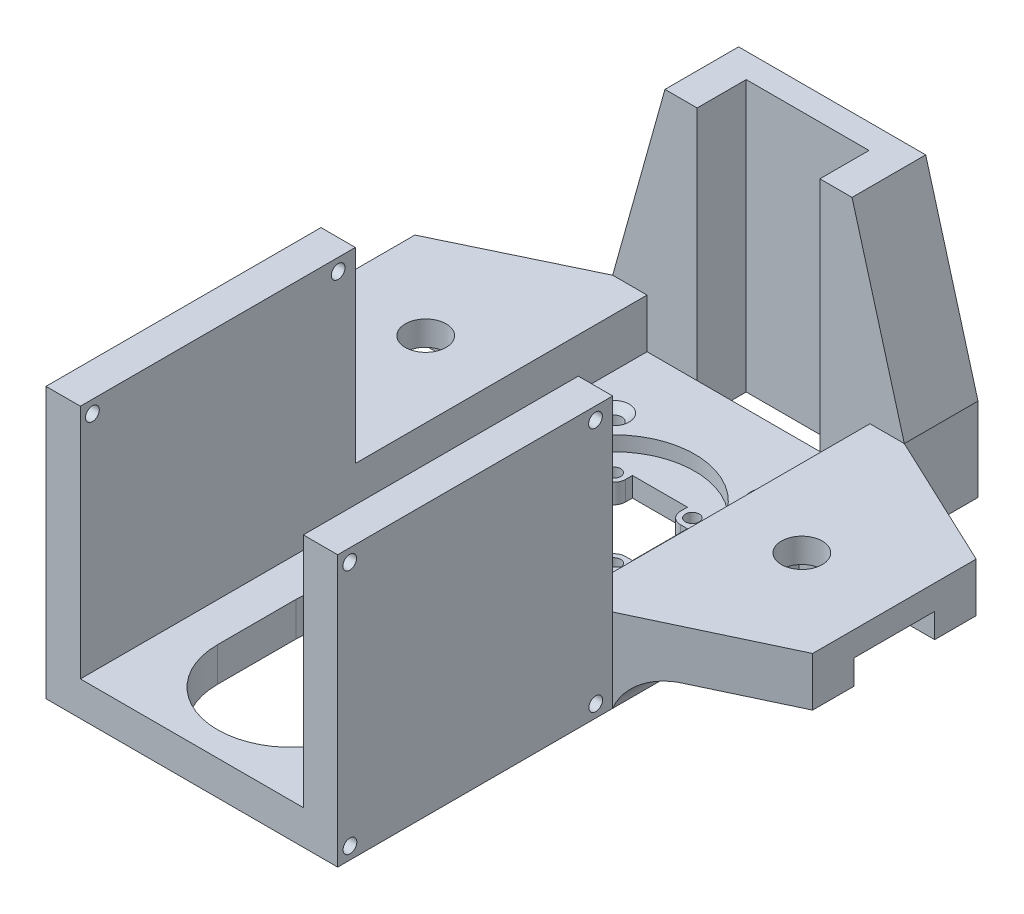
from build123d import *

# Parameters (mm, degrees)
SKETCH1_W           = 59.4
SKETCH1_H           = 59.4
BOSS_EXTRUDE1_DEPTH = 7
SKETCH2_R           = 16.5
CUT_EXTRUDE1_DEPTH  = 3
SKETCH4_R           = 1.65
CUT_EXTRUDE2_DEPTH  = 7
CHAMFER1_SIZE       = 1.5
SKETCH5_R           = 1.4
CUT_EXTRUDE3_DEPTH  = 7
SKETCH6_W           = 7
SKETCH6_H           = 59.4
BOSS_EXTRUDE2_DEPTH = 10
SKETCH7_W           = 27.226691729
SKETCH7_H           = 59.4
SKETCH7_W_2         = 27.673308271
BOSS_EXTRUDE3_DEPTH = 10
SKETCH8_R           = 4.165
CUT_EXTRUDE4_DEPTH  = 10
SKETCH9_W           = 30
SKETCH9_H           = 16.4
SKETCH9_W_2         = 36.39158208
CUT_EXTRUDE5_DEPTH  = 5
CUT_EXTRUDE6_DEPTH  = 10
BOSS_EXTRUDE4_DEPTH = 15
SKETCH12_W          = 25
SKETCH12_H          = 10
CUT_EXTRUDE7_DEPTH  = 90
SKETCH13_R          = 5.3
SKETCH13_R_2        = 3.3
BOSS_EXTRUDE5_DEPTH = 10
SKETCH14_R          = 1.4
CUT_EXTRUDE8_DEPTH  = 10
SKETCH17_W          = 7
SKETCH17_H          = 38.1
SKETCH17_W_2        = 45.4
SKETCH17_H_2        = 7
BOSS_EXTRUDE8_DEPTH = 56
FILLET1_R           = 10
SKETCH18_R          = 1.4
CUT_EXTRUDE10_DEPTH = 65
CUT_EXTRUDE12_DEPTH = 10


with BuildPart() as part:
    # Sketch1 → Boss-Extrude1 (new body)
    with BuildSketch(Plane(origin=(0, 0, 0), x_dir=(1, 0, 0), z_dir=(0, 1, 0))):
        with Locations((-0.223308271, -13.90093985)):
            Rectangle(SKETCH1_W, SKETCH1_H)
    extrude(amount=BOSS_EXTRUDE1_DEPTH)

    # Sketch2 → Cut-Extrude1 (cut)
    with BuildSketch(Plane(origin=(0, 7, 0), x_dir=(1, 0, 0), z_dir=(0, 1, 0))):
        with Locations(Location((0, -13.90093985, 0), (0, 0, 270))):
            Circle(SKETCH2_R)
    extrude(amount=-CUT_EXTRUDE1_DEPTH, mode=Mode.SUBTRACT)

    # Sketch4 → Cut-Extrude2 (cut)
    with BuildSketch(Plane(origin=(0, 7, 0), x_dir=(1, 0, 0), z_dir=(0, 1, 0))):
        with Locations(Location((-15.5, 1.59906015, 0), (0, 0, 270))):
            Circle(SKETCH4_R)
        with Locations(Location((15.5, 1.59906015, 0), (0, 0, 270))):
            Circle(SKETCH4_R)
        with Locations(Location((15.5, -29.40093985, 0), (0, 0, 270))):
            Circle(SKETCH4_R)
        with Locations(Location((-15.5, -29.40093985, 0), (0, 0, 270))):
            Circle(SKETCH4_R)
    extrude(amount=-CUT_EXTRUDE2_DEPTH, mode=Mode.SUBTRACT)

    # Chamfer1
    chamfer1_edges = [part.edges().sort_by_distance(p)[0] for p in [
        (-15.5, 7, 27.75093985),
        (15.5, 7, 27.75093985),
        (15.5, 7, -3.24906015),
        (-15.5, 7, -3.24906015),
    ]]
    chamfer(chamfer1_edges, length=CHAMFER1_SIZE)

    # Sketch5 → Cut-Extrude3 (cut)
    with BuildSketch(Plane(origin=(0, 4, 0), x_dir=(1, 0, 0), z_dir=(0, 1, 0))):
        with BuildLine():
            Line((9.4, -13.90093985), (0, -13.90093985))
            Line((0, -13.90093985), (0, -23.30093985))
            Line((0, -23.30093985), (5.6, -23.30093985))
            Line((5.6, -23.30093985), (5.6, -21.90093985))
            ThreePointArc((5.6, -21.90093985), (6.302943725, -20.203883575), (8, -19.50093985))
            Line((8, -19.50093985), (9.4, -19.50093985))
            Line((9.4, -19.50093985), (9.4, -13.90093985))
        make_face()
        with BuildLine():
            Line((0, -13.90093985), (-9.4, -13.90093985))
            Line((-9.4, -13.90093985), (-9.4, -19.50093985))
            Line((-9.4, -19.50093985), (-8, -19.50093985))
            ThreePointArc((-8, -19.50093985), (-6.302943725, -20.203883575), (-5.6, -21.90093985))
            Line((-5.6, -21.90093985), (-5.6, -23.30093985))
            Line((-5.6, -23.30093985), (0, -23.30093985))
            Line((0, -23.30093985), (0, -13.90093985))
        make_face()
        with BuildLine():
            ThreePointArc((-5.6, -5.90093985), (-6.302943725, -7.597996124), (-8, -8.30093985))
            Line((-8, -8.30093985), (-9.4, -8.30093985))
            Line((-9.4, -8.30093985), (-9.4, -13.90093985))
            Line((-9.4, -13.90093985), (0, -13.90093985))
            Line((0, -13.90093985), (0, -4.50093985))
            Line((0, -4.50093985), (-5.6, -4.50093985))
            Line((-5.6, -4.50093985), (-5.6, -5.90093985))
        make_face()
        with BuildLine():
            Line((0, -4.50093985), (0, -13.90093985))
            Line((0, -13.90093985), (9.4, -13.90093985))
            Line((9.4, -13.90093985), (9.4, -8.30093985))
            Line((9.4, -8.30093985), (8, -8.30093985))
            ThreePointArc((8, -8.30093985), (6.302943725, -7.597996124), (5.6, -5.90093985))
            Line((5.6, -5.90093985), (5.6, -4.50093985))
            Line((5.6, -4.50093985), (0, -4.50093985))
        make_face()
        with Locations(Location((8, -5.90093985, 0), (0, 0, 270))):
            Circle(SKETCH5_R)
        with Locations(Location((-8, -5.90093985, 0), (0, 0, 270))):
            Circle(SKETCH5_R)
        with Locations(Location((-8, -21.90093985, 0), (0, 0, 270))):
            Circle(SKETCH5_R)
        with Locations(Location((8, -21.90093985, 0), (0, 0, 270))):
            Circle(SKETCH5_R)
    extrude(amount=-CUT_EXTRUDE3_DEPTH, mode=Mode.SUBTRACT)

    # Sketch6 → Boss-Extrude2 (add)
    with BuildSketch(Plane(origin=(0, 7, 0), x_dir=(1, 0, 0), z_dir=(0, 1, 0))):
        with Locations((-26.423308271, -13.90093985)):
            Rectangle(SKETCH6_W, SKETCH6_H)
        with Locations((25.976691729, -13.90093985)):
            Rectangle(SKETCH6_W, SKETCH6_H)
    extrude(amount=BOSS_EXTRUDE2_DEPTH)

    # Sketch7 → Boss-Extrude3 (add)
    with BuildSketch(Plane(origin=(0, 17, 0), x_dir=(1, 0, 0), z_dir=(0, 1, 0))):
        with Locations((-43.536654136, -13.90093985)):
            Rectangle(SKETCH7_W, SKETCH7_H)
        with Locations((43.313345865, -13.90093985)):
            Rectangle(SKETCH7_W_2, SKETCH7_H)
    extrude(amount=-BOSS_EXTRUDE3_DEPTH)

    # Sketch8 → Cut-Extrude4 (cut)
    with BuildSketch(Plane.XZ.offset(-7)):
        with Locations(Location((-38.3, 13.90093985, 0), (0, 0, 270))):
            Circle(SKETCH8_R)
        with Locations(Location((38.3, 13.90093985, 0), (0, 0, 270))):
            Circle(SKETCH8_R)
    extrude(amount=-CUT_EXTRUDE4_DEPTH, mode=Mode.SUBTRACT)

    # Sketch9 → Cut-Extrude5 (cut)
    with BuildSketch(Plane.XZ.offset(-7)):
        with Locations((-44.923308271, 13.90093985)):
            Rectangle(SKETCH9_W, SKETCH9_H)
        with Locations((47.672482769, 13.90093985)):
            Rectangle(SKETCH9_W_2, SKETCH9_H)
    extrude(amount=-CUT_EXTRUDE5_DEPTH, mode=Mode.SUBTRACT)

    # Sketch10 → Cut-Extrude6 (cut)
    with BuildSketch(Plane.XZ.offset(-7)):
        Polygon((29.476691729, 43.60093985), (57.15, 30.55093985), (76.62509514, 37.490170253), (62.940914395, 60.152042306), align=None)
        Polygon((29.476691729, -15.79906015), (57.15, -2.74906015), (74.309790283, -17.328421705), (51.423897195, -33.903905564), align=None)
        Polygon((-29.923308271, 43.60093985), (-57.15, 30.55093985), (-87.322044428, 42.719817872), (-44.416875265, 63.284654142), align=None)
        Polygon((-29.923308271, -15.79906015), (-57.15, -2.74906015), (-80.43240027, -17.331293655), (-52.631456994, -33.827579257), align=None)
    extrude(amount=-CUT_EXTRUDE6_DEPTH, mode=Mode.SUBTRACT)

    # Sketch11 → Boss-Extrude4 (add)
    with BuildSketch(Plane(origin=(0, 0, -15.79906015), x_dir=(-1, 0, 0), z_dir=(0, 0, -1))):
        Polygon((-29.476691729, 17), (-29.476691729, 0), (29.923308271, 0), (29.923308271, 17), (19.273308271, 55.1), (-18.826691729, 55.1), align=None)
    extrude(amount=BOSS_EXTRUDE4_DEPTH)

    # Sketch12 → Cut-Extrude7 (cut)
    with BuildSketch(Plane(origin=(0, 55.1, 0), x_dir=(1, 0, 0), z_dir=(0, 1, 0))):
        with Locations((-0.223308271, 20.79906015)):
            Rectangle(SKETCH12_W, SKETCH12_H)
    extrude(amount=-CUT_EXTRUDE7_DEPTH, mode=Mode.SUBTRACT)

    # Sketch13 → Boss-Extrude5 (add)
    # profile 1 of 2: a face of its own
    with BuildSketch(Plane.XZ):
        with BuildLine():
            Line((-29.923308271, -30.79906015), (-3.367178173, -50.365918718))
            ThreePointArc((-3.367178173, -50.365918718), (-2.613652338, -41.368705487), (5.076691729, -46.09906015))
            ThreePointArc((5.076691729, -46.09906015), (4.507046393, -48.489404218), (2.920561631, -50.365918718))
            Line((2.920561631, -50.365918718), (29.476691729, -30.79906015))
            Line((29.476691729, -30.79906015), (-29.923308271, -30.79906015))
        make_face()
    # profile 2 of 2: a face of its own
    with BuildSketch(Plane.XZ):
        with Locations((-0.223308271, -46.09906015)):
            Circle(SKETCH13_R)
        with Locations(Location((-0.223308271, -46.09906015, 0), (0, 0, 270))):
            Circle(SKETCH13_R_2, mode=Mode.SUBTRACT)
    extrude(amount=-BOSS_EXTRUDE5_DEPTH)

    # Sketch14 → Cut-Extrude8 (cut)
    with BuildSketch(Plane(origin=(0, 0, -30.79906015), x_dir=(-1, 0, 0), z_dir=(0, 0, -1))):
        with Locations((-24.776691729, 12.7)):
            Circle(SKETCH14_R)
        with Locations((25.223308271, 12.7)):
            Circle(SKETCH14_R)
    extrude(amount=-CUT_EXTRUDE8_DEPTH, mode=Mode.SUBTRACT)

    # Sketch17 → Boss-Extrude8 (add)
    with BuildSketch(Plane.XY.offset(43.60093985)):
        with Locations((-26.423308271, 36.05)):
            Rectangle(SKETCH17_W, SKETCH17_H)
        Polygon((-22.923308271, 0), (-22.923308271, 7), (-22.923308271, 17), (-29.923308271, 17), (-29.923308271, 7), (-29.923308271, 0), align=None)
        with Locations((-0.223308271, 3.5)):
            Rectangle(SKETCH17_W_2, SKETCH17_H_2)
        Polygon((22.476691729, 17), (22.476691729, 7), (22.476691729, 0), (29.476691729, 0), (29.476691729, 7), (29.476691729, 17), align=None)
        with Locations((25.976691729, 36.05)):
            Rectangle(SKETCH17_W, SKETCH17_H)
    extrude(amount=BOSS_EXTRUDE8_DEPTH)

    # Fillet1
    # the kernel refuses this fillet: 10 mm, written as the material it adds along each edge
    with BuildSketch(Plane(origin=(-29.923308271, 7, 67.449419885), x_dir=(0, -1, 0), z_dir=(0, 0, -1))) as fillet1_piece_1_section:
        with BuildLine():
            CenterArc((10, 9.539392014), FILLET1_R, 180, 72.542396876)
            Line((0, 9.539392014), (-0.2, 9.539392014))
            Line((-0.2, 9.539392014), (-0.2, 0))
            Line((-0.2, 0), (0, -0.2))
            ThreePointArc((0, -0.2), (3.5, -0.2), (6.94, -0.19078784))
            Line((6.94, -0.19078784), (7, 0))
        make_face()
    fillet1_piece_1 = extrude(amount=45.348480035, mode=Mode.PRIVATE)
    fillet1_piece_1 = split(fillet1_piece_1, bisect_by=Plane(origin=(-36.079766586, 5.164687133, 40.650093606), z_dir=(0.43222460559101666, 0, -0.9017659842340973)), keep=Keep.TOP, mode=Mode.PRIVATE)
    add(fillet1_piece_1)
    with BuildSketch(Plane(origin=(-29.923308271, 7, 67.449419885), x_dir=(0, -1, 0), z_dir=(0, 0, -1))) as fillet1_piece_2_section:
        with BuildLine():
            CenterArc((10, 9.539392014), FILLET1_R, 180, 72.542396876)
            Line((0, 9.539392014), (-0.2, 9.539392014))
            Line((-0.2, 9.539392014), (-0.2, 0))
            Line((-0.2, 0), (0, -0.2))
            ThreePointArc((0, -0.2), (3.5, -0.2), (6.94, -0.19078784))
            Line((6.94, -0.19078784), (7, 0))
        make_face()
    fillet1_piece_2 = extrude(amount=69.196960071, mode=Mode.PRIVATE)
    fillet1_piece_2 = split(fillet1_piece_2, bisect_by=Plane(origin=(-32.194534149, 5.212182004, 5.70093985), z_dir=(0, 0, -1)), keep=Keep.TOP, mode=Mode.PRIVATE)
    add(fillet1_piece_2)
    with BuildSketch(Plane(origin=(29.476691729, 7, -39.647540186), x_dir=(0, -1, 0), z_dir=(0, 0, 1))) as fillet1_piece_3_section:
        with BuildLine():
            CenterArc((10, 9.539392014), FILLET1_R, 180, 72.542396876)
            Line((0, 9.539392014), (-0.2, 9.539392014))
            Line((-0.2, 9.539392014), (-0.2, 0))
            Line((-0.2, 0), (0, -0.2))
            ThreePointArc((0, -0.2), (3.5, -0.2), (6.94, -0.19078784))
            Line((6.94, -0.19078784), (7, 0))
        make_face()
    fillet1_piece_3 = extrude(amount=45.348480035, mode=Mode.PRIVATE)
    fillet1_piece_3 = split(fillet1_piece_3, bisect_by=Plane(origin=(35.597218228, 5.165493834, -12.91278179), z_dir=(-0.4265265085615614, 0, 0.9044750618421077)), keep=Keep.TOP, mode=Mode.PRIVATE)
    add(fillet1_piece_3)
    with BuildSketch(Plane(origin=(29.476691729, 7, -39.647540186), x_dir=(0, -1, 0), z_dir=(0, 0, 1))) as fillet1_piece_4_section:
        with BuildLine():
            CenterArc((10, 9.539392014), FILLET1_R, 180, 72.542396876)
            Line((0, 9.539392014), (-0.2, 9.539392014))
            Line((-0.2, 9.539392014), (-0.2, 0))
            Line((-0.2, 0), (0, -0.2))
            ThreePointArc((0, -0.2), (3.5, -0.2), (6.94, -0.19078784))
            Line((6.94, -0.19078784), (7, 0))
        make_face()
    fillet1_piece_4 = extrude(amount=69.196960071, mode=Mode.PRIVATE)
    fillet1_piece_4 = split(fillet1_piece_4, bisect_by=Plane(origin=(31.747917608, 5.212182004, 22.10093985), z_dir=(0, 0, 1)), keep=Keep.TOP, mode=Mode.PRIVATE)
    add(fillet1_piece_4)
    with BuildSketch(Plane(origin=(29.476691729, 7, -1.747540186), x_dir=(0, -1, 0), z_dir=(0, 0, 1))) as fillet1_piece_5_section:
        with BuildLine():
            CenterArc((10, 9.539392014), FILLET1_R, 180, 72.542396876)
            Line((0, 9.539392014), (-0.2, 9.539392014))
            Line((-0.2, 9.539392014), (-0.2, 0))
            Line((-0.2, 0), (0, -0.2))
            ThreePointArc((0, -0.2), (3.5, -0.2), (6.94, -0.19078784))
            Line((6.94, -0.19078784), (7, 0))
        make_face()
    fillet1_piece_5 = extrude(amount=69.196960071, mode=Mode.PRIVATE)
    fillet1_piece_5 = split(fillet1_piece_5, bisect_by=Plane(origin=(31.747917608, 5.212182004, 5.70093985), z_dir=(0, 0, -1)), keep=Keep.TOP, mode=Mode.PRIVATE)
    add(fillet1_piece_5)
    with BuildSketch(Plane(origin=(29.476691729, 7, 22.10093985), x_dir=(0, -1, 0), z_dir=(0, 0, 1))) as fillet1_piece_6_section:
        with BuildLine():
            CenterArc((10, 9.539392014), FILLET1_R, 180, 72.542396876)
            Line((0, 9.539392014), (-0.2, 9.539392014))
            Line((-0.2, 9.539392014), (-0.2, 0))
            Line((-0.2, 0), (0, -0.2))
            ThreePointArc((0, -0.2), (3.5, -0.2), (6.94, -0.19078784))
            Line((6.94, -0.19078784), (7, 0))
        make_face()
    fillet1_piece_6 = extrude(amount=45.348480035, mode=Mode.PRIVATE)
    fillet1_piece_6 = split(fillet1_piece_6, bisect_by=Plane(origin=(35.597218228, 5.165493834, 40.71466149), z_dir=(-0.4265265085615609, 0, -0.9044750618421078)), keep=Keep.TOP, mode=Mode.PRIVATE)
    add(fillet1_piece_6)
    with BuildSketch(Plane(origin=(-29.923308271, 7, 29.549419885), x_dir=(0, -1, 0), z_dir=(0, 0, -1))) as fillet1_piece_7_section:
        with BuildLine():
            CenterArc((10, 9.539392014), FILLET1_R, 180, 72.542396876)
            Line((0, 9.539392014), (-0.2, 9.539392014))
            Line((-0.2, 9.539392014), (-0.2, 0))
            Line((-0.2, 0), (0, -0.2))
            ThreePointArc((0, -0.2), (3.5, -0.2), (6.94, -0.19078784))
            Line((6.94, -0.19078784), (7, 0))
        make_face()
    fillet1_piece_7 = extrude(amount=69.196960071, mode=Mode.PRIVATE)
    fillet1_piece_7 = split(fillet1_piece_7, bisect_by=Plane(origin=(-32.194534149, 5.212182004, 22.10093985), z_dir=(0, 0, 1)), keep=Keep.TOP, mode=Mode.PRIVATE)
    add(fillet1_piece_7)
    with BuildSketch(Plane(origin=(-29.923308271, 7, 5.70093985), x_dir=(0, -1, 0), z_dir=(0, 0, -1))) as fillet1_piece_8_section:
        with BuildLine():
            CenterArc((10, 9.539392014), FILLET1_R, 180, 72.542396876)
            Line((0, 9.539392014), (-0.2, 9.539392014))
            Line((-0.2, 9.539392014), (-0.2, 0))
            Line((-0.2, 0), (0, -0.2))
            ThreePointArc((0, -0.2), (3.5, -0.2), (6.94, -0.19078784))
            Line((6.94, -0.19078784), (7, 0))
        make_face()
    fillet1_piece_8 = extrude(amount=45.348480035, mode=Mode.PRIVATE)
    fillet1_piece_8 = split(fillet1_piece_8, bisect_by=Plane(origin=(-36.079766586, 5.164687133, -12.848213907), z_dir=(0.4322246055910173, 0, 0.901765984234097)), keep=Keep.TOP, mode=Mode.PRIVATE)
    add(fillet1_piece_8)

    # Sketch18 → Cut-Extrude10 (cut)
    with BuildSketch(Plane(origin=(29.476691729, 0, 0), x_dir=(0, 0, -1), z_dir=(1, 0, 0))):
        with Locations((-97.10093985, 2.5)):
            Circle(SKETCH18_R)
        with Locations((-97.15093985, 52.55)):
            Circle(SKETCH18_R)
        with Locations((-47.10093985, 52.6)):
            Circle(SKETCH18_R)
        with Locations((-47.05093985, 2.55)):
            Circle(SKETCH18_R)
    extrude(amount=-CUT_EXTRUDE10_DEPTH, mode=Mode.SUBTRACT)

    # Sketch19 → Cut-Extrude12 (cut)
    with BuildSketch(Plane(origin=(0, 7, 0), x_dir=(1, 0, 0), z_dir=(0, 1, 0))):
        with BuildLine():
            Line((-15, -79.60093985), (-15, -63.60093985))
            ThreePointArc((-15, -63.60093985), (0, -48.60093985), (15, -63.60093985))
            Line((15, -63.60093985), (15, -79.60093985))
            ThreePointArc((15, -79.60093985), (0, -94.60093985), (-15, -79.60093985))
        make_face()
    extrude(amount=-CUT_EXTRUDE12_DEPTH, mode=Mode.SUBTRACT)


solid = part.part
